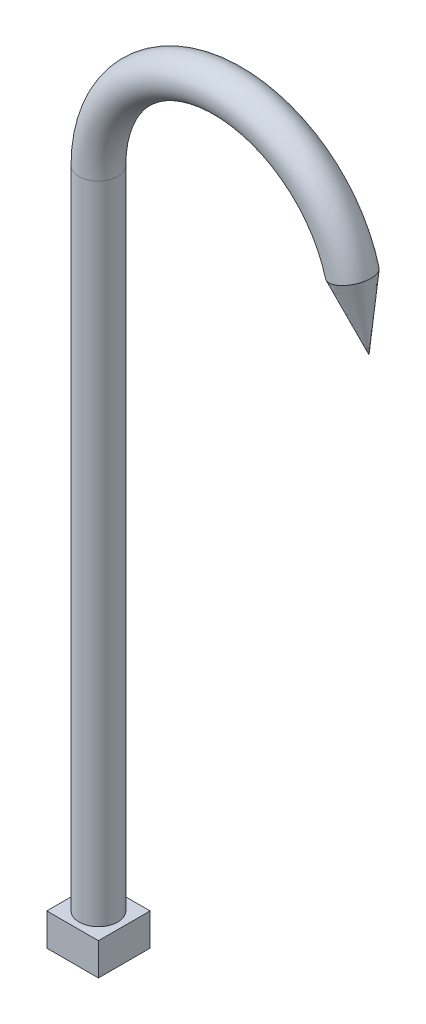
from build123d import *

# Parameters (mm, degrees)
SKETCH1_W           = 8
SKETCH1_H           = 8
BOSS_EXTRUDE1_DEPTH = 5
SKETCH3_R           = 3
CHAMFER1_SIZE2      = 3
CHAMFER1_SIZE       = 10


with BuildPart() as part:
    # Sketch1 → Boss-Extrude1 (new body)
    with BuildSketch(Plane(origin=(0, 0, 0), x_dir=(1, 0, 0), z_dir=(0, 1, 0))):
        Rectangle(SKETCH1_W, SKETCH1_H)
    extrude(amount=BOSS_EXTRUDE1_DEPTH)

    # Sweep1: sweep along a path in Sketch2
    with BuildLine(Plane.XY) as sweep1_path:
        Line((0, 5), (0, 105))
        ThreePointArc((0, 105), (17.389476156, 124.828897227), (39.318516526, 110.176380902))
        Line((39.318516526, 110.176380902), (41.906706977, 100.517122639))
    # Sketch3 → Sweep1 (sweep)
    with BuildSketch(Plane(origin=(0, 5, 0), x_dir=(1, 0, 0), z_dir=(0, 1, 0))):
        Circle(SKETCH3_R)
    sweep(path=sweep1_path.line)

    # Chamfer1
    chamfer1_edges = [part.edges().sort_by_distance(p)[0] for p in [
        (44.804484456, 101.293579774, 0),
    ]]
    chamfer1_side = [part.faces().sort_by_distance(p)[0] for p in [
        (44.788955313, 101.351535324, 0),
    ]]
    chamfer(chamfer1_edges, length=CHAMFER1_SIZE - 0.0001, length2=CHAMFER1_SIZE2 - 0.0001, reference=chamfer1_side[0])  # a hair under: the kernel refuses the full size


solid = part.part
